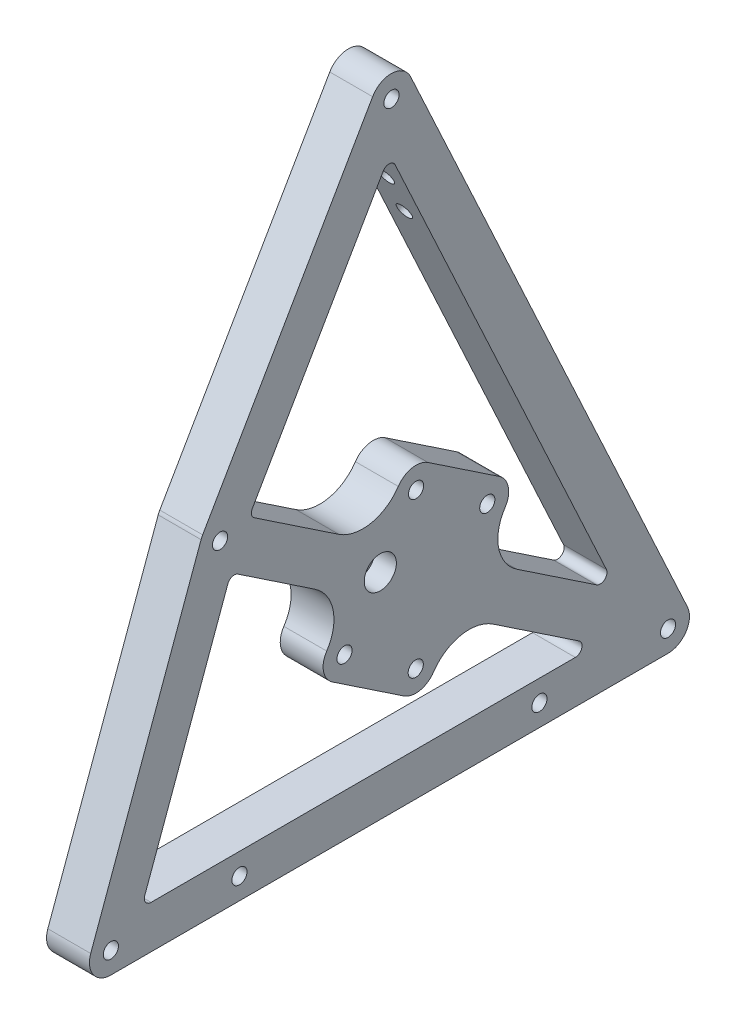
from build123d import *

# Parameters (mm, degrees)
SKETCH2_R           = 2.25
BOSS_EXTRUDE1_DEPTH = 12.7
FILLET1_R           = 6.35
FILLET2_R           = 2
CUT_EXTRUDE2_START  = 12.7
SKETCH3_R           = 4.7625
SKETCH3_R_2         = 2.25
CUT_EXTRUDE2_DEPTH  = 6.35
SKETCH3_3_R         = 2.25
BOSS_EXTRUDE2_DEPTH = 12.7
FILLET3_R           = 6.35
CUT_EXTRUDE3_REACH  = 181.366
SKETCH4_R           = 2.25
CUT_EXTRUDE4_START  = 12.7
SKETCH3_4_R         = 2.25
CUT_EXTRUDE4_DEPTH  = 182.75835677
FILLET4_R           = 12.7


with BuildPart() as part:
    # Sketch2 → Boss-Extrude1 (new body)
    with BuildSketch(Plane(origin=(0, 0, 0), x_dir=(0, 0, -1), z_dir=(1, 0, 0))):
        Polygon((-41.425693669, -95.25), (142.682929389, -95.25), (51.328891162, 101.953428549), (-5.433161507, 3.638669384), align=None)
        Circle(SKETCH2_R, mode=Mode.SUBTRACT)
        with Locations((50.8, 87.988181024)):
            Circle(SKETCH2_R, mode=Mode.SUBTRACT)
        with Locations((-32.356953826, -88.9)):
            Circle(SKETCH2_R, mode=Mode.SUBTRACT)
        with Locations((132.743046174, -88.9)):
            Circle(SKETCH2_R, mode=Mode.SUBTRACT)
        with Locations((5.743046174, -88.9)):
            Circle(SKETCH2_R, mode=Mode.SUBTRACT)
        with Locations((94.643046174, -88.9)):
            Circle(SKETCH2_R, mode=Mode.SUBTRACT)
        Polygon((-23.288213983, -82.55), (3.196675109, -9.783365262), (111.849821959, -82.55), align=None, mode=Mode.SUBTRACT)
        Polygon((8.615197161, 1.87277804), (117.46426423, -71.025067394), (50.271108838, 74.0229335), align=None, mode=Mode.SUBTRACT)
    extrude(amount=BOSS_EXTRUDE1_DEPTH)

    # Fillet1
    fillet1_edges = [part.edges().sort_by_distance(p)[0] for p in [
        (6.35, 3.638669384, 5.433161507),
        (6.35, 101.953428549, -51.328891162),
        (6.35, -95.25, -142.682929389),
        (6.35, -95.25, 41.425693669),
    ]]
    fillet(fillet1_edges, radius=FILLET1_R)

    # Fillet2
    fillet2_edges = [part.edges().sort_by_distance(p)[0] for p in [
        (6.35, -82.55, 23.288213983),
        (6.35, -82.55, -111.849821959),
        (6.35, -9.783365262, -3.196675109),
        (6.35, 74.0229335, -50.271108838),
        (6.35, 1.87277804, -8.615197161),
        (6.35, -71.025067394, -117.46426423),
    ]]
    fillet(fillet2_edges, radius=FILLET2_R)

    # Sketch3 → Cut-Extrude2 (cut)
    with BuildSketch(Plane(origin=(0, 0, 0), x_dir=(0, 0, -1), z_dir=(1, 0, 0)).offset(CUT_EXTRUDE2_START)):
        with Locations((47.484762838, -31.801254664)):
            Circle(SKETCH3_R)
        with Locations((47.484762838, -31.801254664)):
            Circle(SKETCH3_R_2, mode=Mode.SUBTRACT)
    extrude(amount=-CUT_EXTRUDE2_DEPTH, mode=Mode.SUBTRACT)

    # Sketch3<3> → Boss-Extrude2 (add)
    # profile 1 of 2: a face of its own
    with BuildSketch(Plane(origin=(0, 0, 0), x_dir=(0, 0, -1), z_dir=(1, 0, 0))):
        Polygon((56.34256904, -7.163442885), (45.742150819, -22.991697164), (77.398659377, -44.192533607), (87.999077599, -28.364279328), align=None)
        with Locations((79.189520098, -30.106891347)):
            Circle(SKETCH3_3_R, mode=Mode.SUBTRACT)
        with Locations((58.085181059, -15.973000385)):
            Circle(SKETCH3_3_R, mode=Mode.SUBTRACT)
    # profile 2 of 2: a face of its own
    with BuildSketch(Plane(origin=(0, 0, 0), x_dir=(0, 0, -1), z_dir=(1, 0, 0))):
        Polygon((59.731295675, -70.572957406), (70.331713896, -54.744703127), (38.675205338, -33.543866684), (28.074787116, -49.372120963), align=None)
        with Locations((57.988683656, -61.763399906)):
            Circle(SKETCH3_3_R, mode=Mode.SUBTRACT)
        with Locations((36.884344616, -47.629508944)):
            Circle(SKETCH3_3_R, mode=Mode.SUBTRACT)
    extrude(amount=BOSS_EXTRUDE2_DEPTH)

    # Fillet3
    fillet3_edges = [part.edges().sort_by_distance(p)[0] for p in [
        (6.35, -28.364279328, -87.999077599),
        (6.35, -7.163442885, -56.34256904),
        (6.35, -49.372120963, -28.074787116),
        (6.35, -70.572957406, -59.731295675),
    ]]
    fillet(fillet3_edges, radius=FILLET3_R)

    # Sketch4 → Cut-Extrude3 (cut, up to next)
    with BuildSketch(Plane(origin=(0, 37.590233469, -81.144994396), x_dir=(-1, 0, 0), z_dir=(0, 0.4203363295122345, -0.9073683761803595)), mode=Mode.PRIVATE) as cut_extrude3_sk1:
        with Locations(Location((-6.35, 20.598120023, 0), (0, 0, 90))):
            Circle(SKETCH4_R)
    cut_extrude3_tool1 = extrude(cut_extrude3_sk1.sketch, amount=-CUT_EXTRUDE3_REACH, mode=Mode.PRIVATE) & part.part
    # Sketch4 → Cut-Extrude3 (cut, up to next)
    with BuildSketch(Plane(origin=(0, 37.590233469, -81.144994396), x_dir=(-1, 0, 0), z_dir=(0, 0.4203363295122345, -0.9073683761803595)), mode=Mode.PRIVATE) as cut_extrude3_sk2:
        with Locations(Location((-6.35, 33.298120023, 0), (0, 0, 90))):
            Circle(SKETCH4_R)
    cut_extrude3_tool2 = extrude(cut_extrude3_sk2.sketch, amount=-CUT_EXTRUDE3_REACH, mode=Mode.PRIVATE) & part.part
    add(cut_extrude3_tool1.solids().sort_by_distance((6.35, 56.280316, -72.486856))[0], mode=Mode.SUBTRACT)
    add(cut_extrude3_tool2.solids().sort_by_distance((6.35, 67.803895, -67.148585))[0], mode=Mode.SUBTRACT)

    # Sketch3<4> → Cut-Extrude4 (cut, through all)
    with BuildSketch(Plane(origin=(0, 0, 0), x_dir=(0, 0, -1), z_dir=(1, 0, 0)).offset(CUT_EXTRUDE4_START)):
        with Locations((47.484762838, -31.801254664)):
            Circle(SKETCH3_4_R)
    extrude(amount=-CUT_EXTRUDE4_DEPTH, mode=Mode.SUBTRACT)

    # Fillet4
    fillet4_edges = [part.edges().sort_by_distance(p)[0] for p in [
        (6.35, -44.192533607, -77.398659377),
        (6.35, -54.744703127, -70.331713896),
        (6.35, -22.991697164, -45.742150819),
        (6.35, -33.543866684, -38.675205338),
    ]]
    fillet(fillet4_edges, radius=FILLET4_R - 0.0001)  # a hair under: the kernel refuses the full size


solid = part.part
